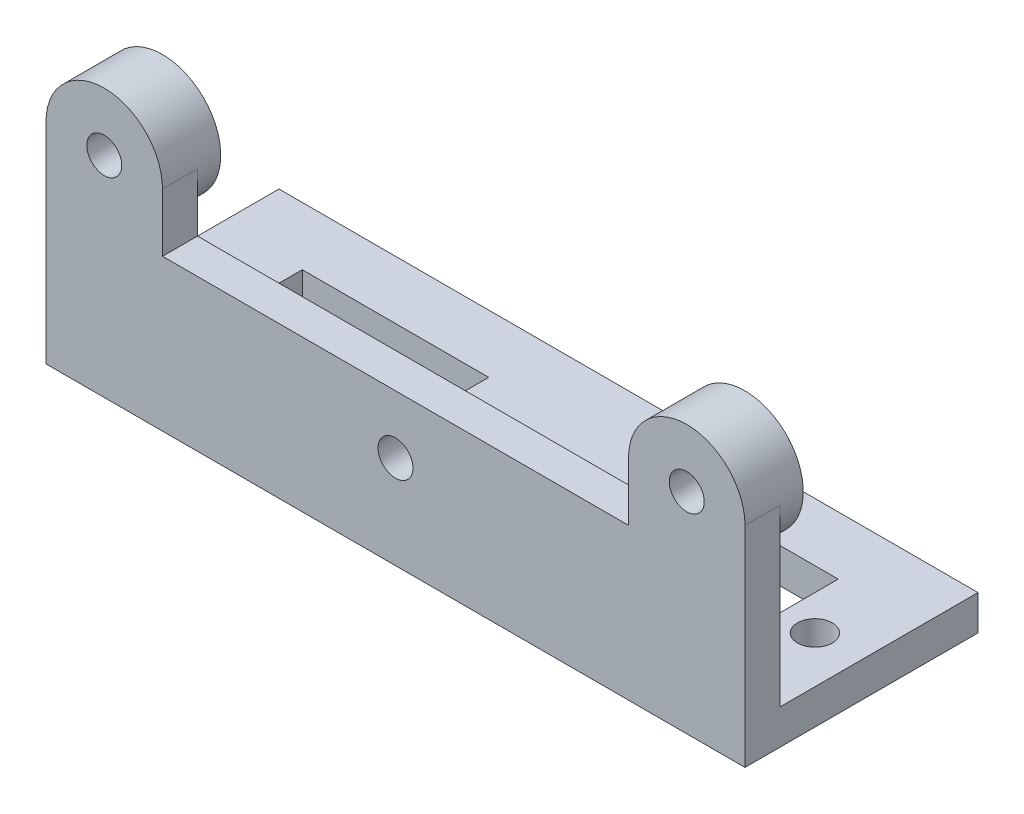
from build123d import *
from build123d.topology import SkipClean

# Parameters (mm, degrees)
SKETCH1_W           = 1524
SKETCH1_H           = 508
SKETCH1_W_2         = 406.4
SKETCH1_H_2         = 254
SKETCH1_R           = 38.1
BOSS_EXTRUDE2_DEPTH = 76.2
SCALE2_SCALE        = 0.039370079
SKETCH3_R           = 1.5
BOSS_EXTRUDE3_DEPTH = 3
SKETCH4_R           = 5
SKETCH4_R_2         = 1.5
BOSS_EXTRUDE5_DEPTH = 2
CUT_EXTRUDE1_START  = -29
CUT_EXTRUDE1_DEPTH  = 29


with BuildPart() as part:
    # Sketch1 → Boss-Extrude2 (new body)
    with BuildSketch(Plane(origin=(0, 0, 0), x_dir=(1, 0, 0), z_dir=(0, 1, 0))):
        with Locations((584.2, 127)):
            Rectangle(SKETCH1_W, SKETCH1_H)
        with Locations((203.2, 127)):
            Rectangle(SKETCH1_W_2, SKETCH1_H_2, mode=Mode.SUBTRACT)
        with Locations((482.6, 127)):
            Circle(SKETCH1_R, mode=Mode.SUBTRACT)
        with Locations((685.8, 127)):
            Circle(SKETCH1_R, mode=Mode.SUBTRACT)
        with Locations((965.2, 127)):
            Rectangle(SKETCH1_W_2, SKETCH1_H_2, mode=Mode.SUBTRACT)
        with Locations((1244.6, 127)):
            Circle(SKETCH1_R, mode=Mode.SUBTRACT)
        with Locations((-76.2, 127)):
            Circle(SKETCH1_R, mode=Mode.SUBTRACT)
    extrude(amount=BOSS_EXTRUDE2_DEPTH)


with BuildPart() as part_1:
    # Scale2: scaled about (584.2, 38.1, -127)
    add(part.part.scale(SCALE2_SCALE).moved(Location((561.2, 36.6, -122))))

    # Sketch3 → Boss-Extrude3 (add)
    with BuildSketch(Plane.XY.offset(-117)):
        Polygon((604.2, 49.6), (564.2, 49.6), (564.2, 59.6), (559.2, 59.6), (554.2, 59.6), (554.2, 39.6), (584.2, 39.6), (614.2, 39.6), (614.2, 59.6), (609.2, 59.6), (604.2, 59.6), align=None)
        with Locations((584.2, 44.6)):
            Circle(SKETCH3_R, mode=Mode.SUBTRACT)
        with Locations((559.2, 54.6)):
            Circle(SKETCH3_R, mode=Mode.SUBTRACT)
        with Locations((609.2, 54.6)):
            Circle(SKETCH3_R, mode=Mode.SUBTRACT)
    extrude(amount=-BOSS_EXTRUDE3_DEPTH)

    # Sketch4 → Boss-Extrude5 (add)
    # profile 1 of 2: a face of its own
    with SkipClean():  # the faces are left unmerged after this step: merging them gives an invalid solid
        with BuildSketch(Plane(origin=(0, 0, -120), x_dir=(-1, 0, 0), z_dir=(0, 0, -1))):
            with Locations((-559.2, 54.6)):
                Circle(SKETCH4_R)
            with Locations((-559.2, 54.6)):
                Circle(SKETCH4_R_2, mode=Mode.SUBTRACT)
        # profile 2 of 2: a face of its own
        with BuildSketch(Plane(origin=(0, 0, -120), x_dir=(-1, 0, 0), z_dir=(0, 0, -1))):
            with Locations((-609.2, 54.6)):
                Circle(SKETCH4_R)
            with Locations((-609.2, 54.6)):
                Circle(SKETCH4_R_2, mode=Mode.SUBTRACT)
        extrude(amount=BOSS_EXTRUDE5_DEPTH)
    add(part_1.part.scale(1), mode=Mode.REPLACE)  # the faces are merged on a copy

    # Sketch5 → Cut-Extrude1 (cut)
    with BuildSketch(Plane(origin=(0, 0, -122), x_dir=(-1, 0, 0), z_dir=(0, 0, -1)).offset(CUT_EXTRUDE1_START)):
        with BuildLine():
            ThreePointArc((-614.2, 54.6), (-612.735533906, 58.135533906), (-609.2, 59.6))
            Line((-609.2, 59.6), (-614.2, 59.6))
            Line((-614.2, 59.6), (-614.2, 54.6))
        make_face()
        with BuildLine():
            Line((-604.2, 59.6), (-609.2, 59.6))
            ThreePointArc((-609.2, 59.6), (-605.664466094, 58.135533906), (-604.2, 54.6))
            Line((-604.2, 54.6), (-604.2, 59.6))
        make_face()
        with BuildLine():
            ThreePointArc((-564.2, 54.6), (-562.735533906, 58.135533906), (-559.2, 59.6))
            Line((-559.2, 59.6), (-564.2, 59.6))
            Line((-564.2, 59.6), (-564.2, 54.6))
        make_face()
        with BuildLine():
            Line((-554.2, 59.6), (-559.2, 59.6))
            ThreePointArc((-559.2, 59.6), (-555.664466094, 58.135533906), (-554.2, 54.6))
            Line((-554.2, 54.6), (-554.2, 59.6))
        make_face()
    extrude(amount=CUT_EXTRUDE1_DEPTH, mode=Mode.SUBTRACT)


solid = part_1.part
